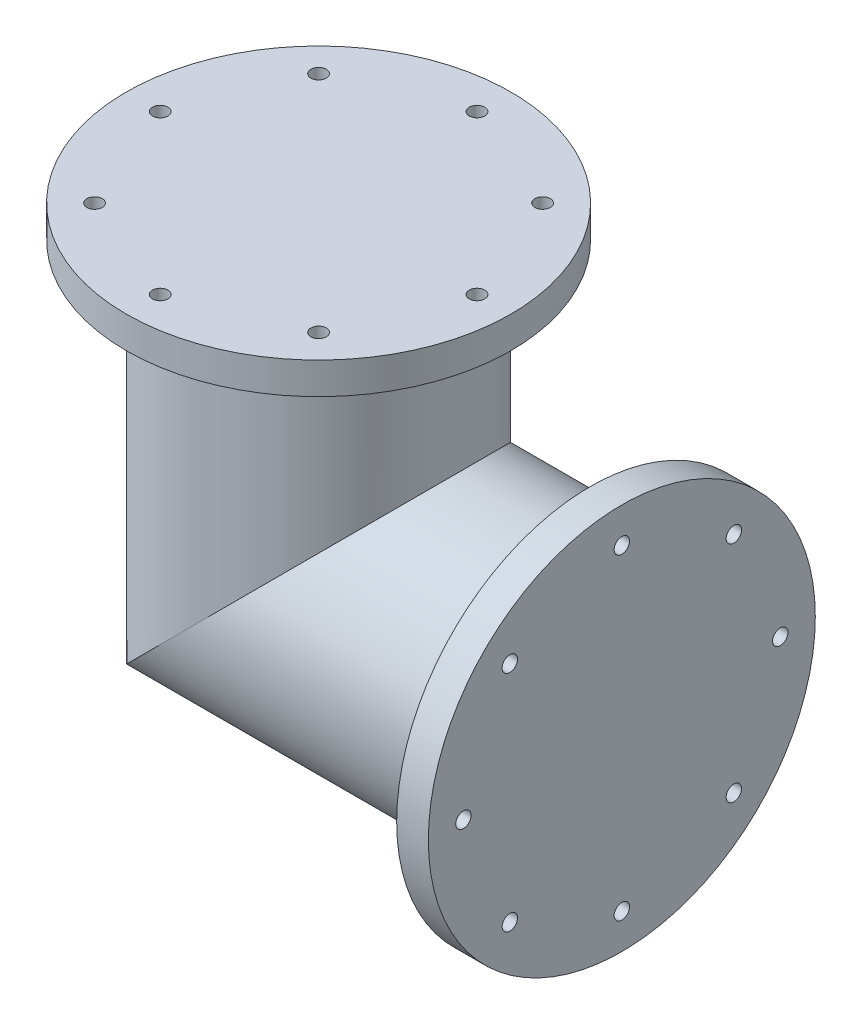
from build123d import *

# Parameters (mm, degrees)
CROQUIS1_R                                     = 42.75
SALIENTE_EXTRUIR1_DEPTH                        = 3.5
SALIENTE_EXTRUIR2_REACH                        = 181
CROQUIS3_R                                     = 30
CROQUIS3_R_2                                   = 25
SALIENTE_EXTRUIR3_REACH                        = 210.151
CROQUIS4_R                                     = 30
CROQUIS4_R_2                                   = 25
REFRENTADO_PARA_TORNILLO_CON_CABEZA_2_COUNT    = 2
REFRENTADO_PARA_TORNILLO_CON_CABEZA_2_PITCH    = 26.787840266
REFRENTADO_PARA_TORNILLO_CON_CABEZA_3_COUNT    = 2
REFRENTADO_PARA_TORNILLO_CON_CABEZA_3_PITCH    = 49.497474683
REFRENTADO_PARA_TORNILLO_CON_CABEZA_4_COUNT    = 2
REFRENTADO_PARA_TORNILLO_CON_CABEZA_4_PITCH    = 64.671567276
REFRENTADO_PARA_TORNILLO_CON_CABEZA_5_COUNT    = 2
REFRENTADO_PARA_TORNILLO_CON_CABEZA_5_PITCH    = 70
REFRENTADO_PARA_TORNILLO_CON_CABEZA_6_COUNT    = 2
REFRENTADO_PARA_TORNILLO_CON_CABEZA_6_PITCH    = 64.671567276
REFRENTADO_PARA_TORNILLO_CON_CABEZA_7_COUNT    = 2
REFRENTADO_PARA_TORNILLO_CON_CABEZA_7_PITCH    = 49.497474683
REFRENTADO_PARA_TORNILLO_CON_CABEZA_8_COUNT    = 2
REFRENTADO_PARA_TORNILLO_CON_CABEZA_8_PITCH    = 26.787840266
CROQUIS8_R                                     = 42.5
SALIENTE_EXTRUIR4_DEPTH                        = 7
REFRENTADO_PARA_TORNILLO_CON_CABEZA_9_AT_COUNT = 2
REFRENTADO_PARA_TORNILLO_CON_CABEZA_9_AT_PITCH = 26.787840266
REFRENTADO_PARA_TORNILLO_CON_CABEZA_10_COUNT   = 2
REFRENTADO_PARA_TORNILLO_CON_CABEZA_10_PITCH   = 49.497474683
REFRENTADO_PARA_TORNILLO_CON_CABEZA_11_COUNT   = 2
REFRENTADO_PARA_TORNILLO_CON_CABEZA_11_PITCH   = 64.671567276
REFRENTADO_PARA_TORNILLO_CON_CABEZA_12_COUNT   = 2
REFRENTADO_PARA_TORNILLO_CON_CABEZA_12_PITCH   = 70
REFRENTADO_PARA_TORNILLO_CON_CABEZA_13_COUNT   = 2
REFRENTADO_PARA_TORNILLO_CON_CABEZA_13_PITCH   = 64.671567276
REFRENTADO_PARA_TORNILLO_CON_CABEZA_14_COUNT   = 2
REFRENTADO_PARA_TORNILLO_CON_CABEZA_14_PITCH   = 49.497474683
REFRENTADO_PARA_TORNILLO_CON_CABEZA_15_COUNT   = 2
REFRENTADO_PARA_TORNILLO_CON_CABEZA_15_PITCH   = 26.787840266


with BuildPart() as part:
    # Croquis1 → Saliente-Extruir1 (new, symmetric)
    with BuildSketch(Plane(origin=(0, 0, 0), x_dir=(0, 0, -1), z_dir=(1, 0, 0))):
        Circle(CROQUIS1_R)
    extrude(amount=SALIENTE_EXTRUIR1_DEPTH, both=True)

    # Saliente-Extruir2: up to this plane
    saliente_extruir2_end = Plane(origin=(-63.5, 0, 0), z_dir=(-0.7071067811865489, 0.7071067811865461, 0))
    # Croquis3 → Saliente-Extruir2 (add, up to the surface)
    with BuildSketch(Plane.ZY.offset(3.5), mode=Mode.PRIVATE) as saliente_extruir2_sk1:
        Circle(CROQUIS3_R)
        Circle(CROQUIS3_R_2, mode=Mode.SUBTRACT)
    saliente_extruir2_tool1 = split(extrude(saliente_extruir2_sk1.sketch, amount=SALIENTE_EXTRUIR2_REACH, mode=Mode.PRIVATE), bisect_by=saliente_extruir2_end, keep=Keep.BOTH, mode=Mode.PRIVATE)
    add(saliente_extruir2_tool1.solids().sort_by_distance((-3.5, 0, -29.151472))[0])

    # Croquis7 → Refrentado para tornillo con cabeza tron (revolve, cut)
    with BuildSketch(Plane(origin=(-3.5, 35, 0), x_dir=(0, 0, 1), z_dir=(0, 1, 0))):
        Polygon((0, 0), (0, 7), (1.7, 7), (1.7, 2.4), (3.5, 2.4), (3.5, 0), align=None)
    refrentado_para_tornillo_con_cabeza_tron = revolve(axis=Axis((-9.85, 35, 0), (1, 0, 0)), mode=Mode.SUBTRACT)

    # Refrentado para tornillo con cabeza  2: Refrentado para tornillo con cabeza tron ×2
    with Locations(*[Vector(0, -0.3826834323650482, 0.9238795325113041) * (i * REFRENTADO_PARA_TORNILLO_CON_CABEZA_2_PITCH) for i in range(1, REFRENTADO_PARA_TORNILLO_CON_CABEZA_2_COUNT)]):
        add(refrentado_para_tornillo_con_cabeza_tron, mode=Mode.SUBTRACT)

    # Refrentado para tornillo con cabeza  3: Refrentado para tornillo con cabeza tron ×2
    with Locations(*[Vector(0, -0.7071067811865158, 0.7071067811865792) * (i * REFRENTADO_PARA_TORNILLO_CON_CABEZA_3_PITCH) for i in range(1, REFRENTADO_PARA_TORNILLO_CON_CABEZA_3_COUNT)]):
        add(refrentado_para_tornillo_con_cabeza_tron, mode=Mode.SUBTRACT)

    # Refrentado para tornillo con cabeza  4: Refrentado para tornillo con cabeza tron ×2
    with Locations(*[Vector(0, -0.9238795325112696, 0.3826834323651312) * (i * REFRENTADO_PARA_TORNILLO_CON_CABEZA_4_PITCH) for i in range(1, REFRENTADO_PARA_TORNILLO_CON_CABEZA_4_COUNT)]):
        add(refrentado_para_tornillo_con_cabeza_tron, mode=Mode.SUBTRACT)

    # Refrentado para tornillo con cabeza  5: Refrentado para tornillo con cabeza tron ×2
    with Locations(*[(0, -i * REFRENTADO_PARA_TORNILLO_CON_CABEZA_5_PITCH, 0) for i in range(1, REFRENTADO_PARA_TORNILLO_CON_CABEZA_5_COUNT)]):
        add(refrentado_para_tornillo_con_cabeza_tron, mode=Mode.SUBTRACT)

    # Refrentado para tornillo con cabeza  6: Refrentado para tornillo con cabeza tron ×2
    with Locations(*[Vector(0, -0.923879532511304, -0.38268343236504837) * (i * REFRENTADO_PARA_TORNILLO_CON_CABEZA_6_PITCH) for i in range(1, REFRENTADO_PARA_TORNILLO_CON_CABEZA_6_COUNT)]):
        add(refrentado_para_tornillo_con_cabeza_tron, mode=Mode.SUBTRACT)

    # Refrentado para tornillo con cabeza  7: Refrentado para tornillo con cabeza tron ×2
    with Locations(*[Vector(0, -0.7071067811865792, -0.7071067811865158) * (i * REFRENTADO_PARA_TORNILLO_CON_CABEZA_7_PITCH) for i in range(1, REFRENTADO_PARA_TORNILLO_CON_CABEZA_7_COUNT)]):
        add(refrentado_para_tornillo_con_cabeza_tron, mode=Mode.SUBTRACT)

    # Refrentado para tornillo con cabeza  8: Refrentado para tornillo con cabeza tron ×2
    with Locations(*[Vector(0, -0.3826834323651309, -0.9238795325112698) * (i * REFRENTADO_PARA_TORNILLO_CON_CABEZA_8_PITCH) for i in range(1, REFRENTADO_PARA_TORNILLO_CON_CABEZA_8_COUNT)]):
        add(refrentado_para_tornillo_con_cabeza_tron, mode=Mode.SUBTRACT)


with BuildPart() as body_2:
    # Saliente-Extruir3: up to this plane
    saliente_extruir3_end = Plane(origin=(-63.5, 0, 0), z_dir=(-0.7071067811865489, 0.7071067811865461, 0))
    # Croquis4 → Saliente-Extruir3 (new, up to the surface)
    with BuildSketch(Plane(origin=(0, 60, 0), x_dir=(1, 0, 0), z_dir=(0, 1, 0)), mode=Mode.PRIVATE) as saliente_extruir3_sk1:
        with Locations((-63.5, 0)):
            Circle(CROQUIS4_R)
        with Locations((-63.5, 0)):
            Circle(CROQUIS4_R_2, mode=Mode.SUBTRACT)
    saliente_extruir3_tool1 = split(extrude(saliente_extruir3_sk1.sketch, amount=-SALIENTE_EXTRUIR3_REACH, mode=Mode.PRIVATE), bisect_by=saliente_extruir3_end, keep=Keep.BOTH, mode=Mode.PRIVATE)
    add(saliente_extruir3_tool1.solids().sort_by_distance((-92.651472, 60, 0))[0])

    # Croquis8 → Saliente-Extruir4 (add)
    with BuildSketch(Plane(origin=(0, 60, 0), x_dir=(1, 0, 0), z_dir=(0, 1, 0))):
        with Locations((-63.5, 0)):
            Circle(CROQUIS8_R)
    extrude(amount=SALIENTE_EXTRUIR4_DEPTH)

    # Croquis10 → Refrentado para tornillo con cabeza  9 (revolve, cut)
    with BuildSketch(Plane(origin=(-63.5, 60, 35), x_dir=(0, 0, -1), z_dir=(1, 0, 0))):
        Polygon((0, 0), (0, 7.001), (1.7, 7.001), (1.7, 2.4), (3.5, 2.4), (3.5, 0), align=None)
    refrentado_para_tornillo_con_cabeza_9 = revolve(axis=Axis((-63.5, 53.65, 35), (0, 1, 0)), mode=Mode.SUBTRACT)

    # Refrentado para tornillo con cabeza 9 at: Refrentado para tornillo con cabeza  9 ×2
    with Locations(*[Vector(0.9238795325112872, 0, -0.3826834323650887) * (i * REFRENTADO_PARA_TORNILLO_CON_CABEZA_9_AT_PITCH) for i in range(1, REFRENTADO_PARA_TORNILLO_CON_CABEZA_9_AT_COUNT)]):
        add(refrentado_para_tornillo_con_cabeza_9, mode=Mode.SUBTRACT)

    # Refrentado para tornillo con cabeza  10: Refrentado para tornillo con cabeza  9 ×2
    with Locations(*[Vector(0.7071067811865482, 0, -0.7071067811865469) * (i * REFRENTADO_PARA_TORNILLO_CON_CABEZA_10_PITCH) for i in range(1, REFRENTADO_PARA_TORNILLO_CON_CABEZA_10_COUNT)]):
        add(refrentado_para_tornillo_con_cabeza_9, mode=Mode.SUBTRACT)

    # Refrentado para tornillo con cabeza  11: Refrentado para tornillo con cabeza  9 ×2
    with Locations(*[Vector(0.3826834323650904, 0, -0.9238795325112866) * (i * REFRENTADO_PARA_TORNILLO_CON_CABEZA_11_PITCH) for i in range(1, REFRENTADO_PARA_TORNILLO_CON_CABEZA_11_COUNT)]):
        add(refrentado_para_tornillo_con_cabeza_9, mode=Mode.SUBTRACT)

    # Refrentado para tornillo con cabeza  12: Refrentado para tornillo con cabeza  9 ×2
    with Locations(*[(0, 0, -i * REFRENTADO_PARA_TORNILLO_CON_CABEZA_12_PITCH) for i in range(1, REFRENTADO_PARA_TORNILLO_CON_CABEZA_12_COUNT)]):
        add(refrentado_para_tornillo_con_cabeza_9, mode=Mode.SUBTRACT)

    # Refrentado para tornillo con cabeza  13: Refrentado para tornillo con cabeza  9 ×2
    with Locations(*[Vector(-0.382683432365089, 0, -0.9238795325112871) * (i * REFRENTADO_PARA_TORNILLO_CON_CABEZA_13_PITCH) for i in range(1, REFRENTADO_PARA_TORNILLO_CON_CABEZA_13_COUNT)]):
        add(refrentado_para_tornillo_con_cabeza_9, mode=Mode.SUBTRACT)

    # Refrentado para tornillo con cabeza  14: Refrentado para tornillo con cabeza  9 ×2
    with Locations(*[Vector(-0.707106781186547, 0, -0.7071067811865481) * (i * REFRENTADO_PARA_TORNILLO_CON_CABEZA_14_PITCH) for i in range(1, REFRENTADO_PARA_TORNILLO_CON_CABEZA_14_COUNT)]):
        add(refrentado_para_tornillo_con_cabeza_9, mode=Mode.SUBTRACT)

    # Refrentado para tornillo con cabeza  15: Refrentado para tornillo con cabeza  9 ×2
    with Locations(*[Vector(-0.9238795325112865, 0, -0.3826834323650904) * (i * REFRENTADO_PARA_TORNILLO_CON_CABEZA_15_PITCH) for i in range(1, REFRENTADO_PARA_TORNILLO_CON_CABEZA_15_COUNT)]):
        add(refrentado_para_tornillo_con_cabeza_9, mode=Mode.SUBTRACT)


solid = Compound([part.part, body_2.part])
